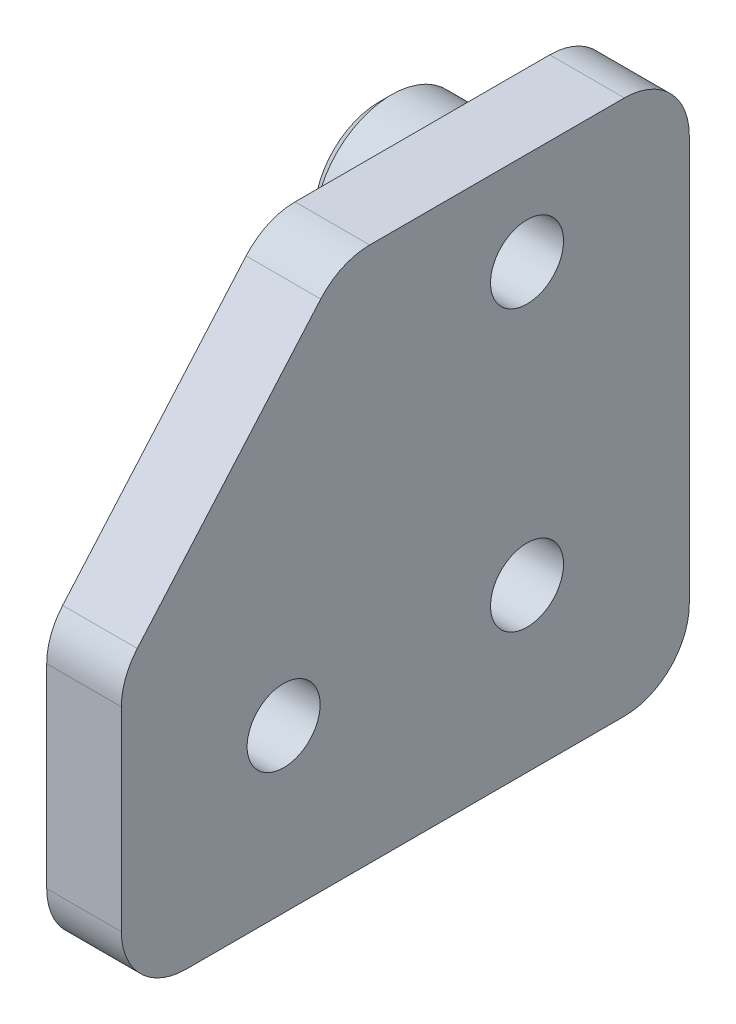
from build123d import *

# Parameters (mm, degrees)
SKETCH1_R           = 2.25
BOSS_EXTRUDE1_DEPTH = 4.6
SKETCH2_R           = 4.75
SKETCH2_R_2         = 2.5
BOSS_EXTRUDE2_DEPTH = 4.5
CHAMFER1_SIZE       = 0.75


with BuildPart() as part:
    # Sketch1 → Boss-Extrude1 (new body)
    with BuildSketch(Plane(origin=(0, 0, 0), x_dir=(0, 0, -1), z_dir=(1, 0, 0))):
        with BuildLine():
            Line((-21, -10), (6, -10))
            ThreePointArc((6, -10), (8.828427125, -8.828427125), (10, -6))
            Line((10, -6), (10, 19))
            ThreePointArc((10, 19), (8.828427125, 21.828427125), (6, 23))
            Line((6, 23), (-9.695652174, 23))
            ThreePointArc((-9.695652174, 23), (-11.354136506, 22.63997661), (-12.714074263, 21.62471486))
            Line((-12.714074263, 21.62471486), (-24.018422089, 8.62471486))
            ThreePointArc((-24.018422089, 8.62471486), (-24.746577662, 7.401126626), (-25, 6))
            Line((-25, 6), (-25, -6))
            ThreePointArc((-25, -6), (-23.828427125, -8.828427125), (-21, -10))
        make_face()
        with Locations((-15, 0)):
            Circle(SKETCH1_R, mode=Mode.SUBTRACT)
        with Locations((0, 17.25)):
            Circle(SKETCH1_R, mode=Mode.SUBTRACT)
        Circle(SKETCH1_R, mode=Mode.SUBTRACT)
    extrude(amount=BOSS_EXTRUDE1_DEPTH)

    # Sketch2 → Boss-Extrude2 (add)
    with BuildSketch(Plane.ZY):
        with Locations((0, 17.25)):
            Circle(SKETCH2_R)
        with Locations((0, 17.25)):
            Circle(SKETCH2_R_2, mode=Mode.SUBTRACT)
    extrude(amount=BOSS_EXTRUDE2_DEPTH)

    # Chamfer1
    chamfer1_edges = [part.edges().sort_by_distance(p)[0] for p in [
        (-4.5, 17.25, -4.75),
    ]]
    chamfer(chamfer1_edges, length=CHAMFER1_SIZE)


solid = part.part
